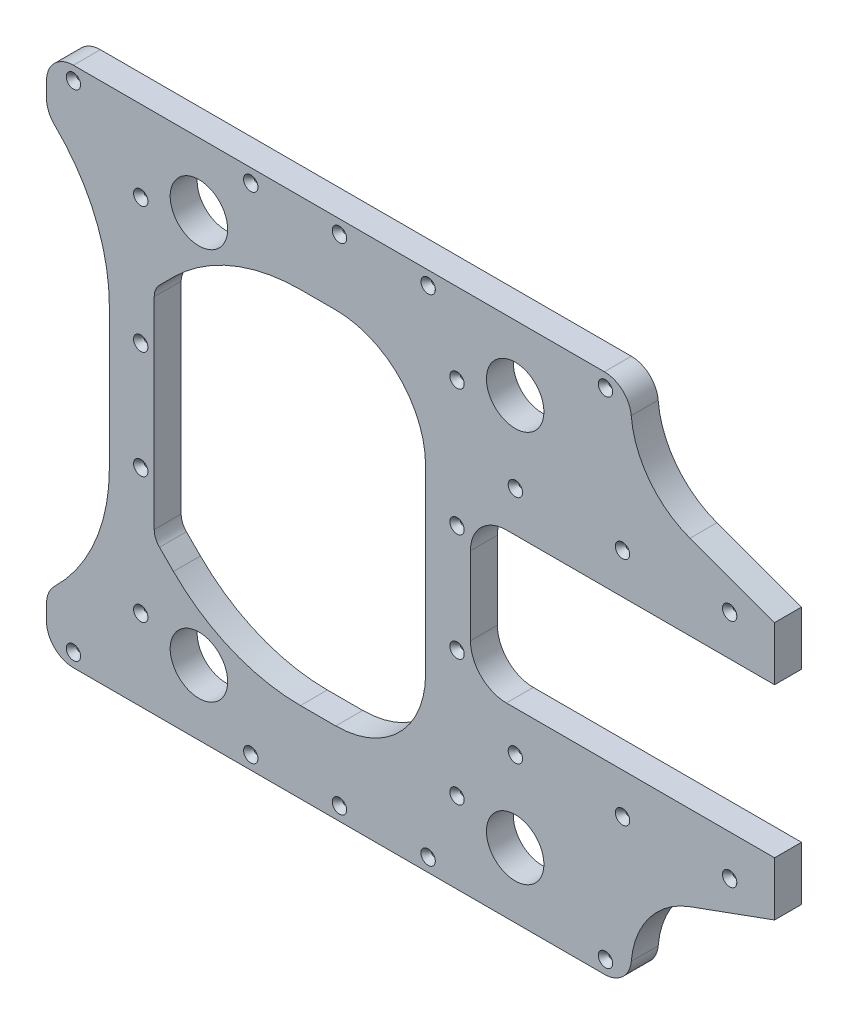
from build123d import *

# Parameters (mm, degrees)
SKETCH1_W                = 413.304725944
SKETCH1_H                = 369.049999988
BOSS_EXTRUDE1_DEPTH      = 19.05
F_1_1_6_DIAMETER_HOLE1_D = 40.64
SKETCH2_W                = 44.45
SKETCH2_H                = 292.849999988
CUT_EXTRUDE1_DEPTH       = 671.615895659
BOSS_EXTRUDE2_DEPTH      = 19.05
CUT_EXTRUDE2_DEPTH       = 760.092595873
FILLET1_R                = 127
FILLET2_R                = 63.5
FILLET3_R                = 19.05
SKETCH7_W                = 215.05772584
SKETCH7_H                = 105.949999994
CUT_EXTRUDE3_DEPTH       = 760.09259601
FILLET4_R                = 25.4
HOLE1_D                  = 3.175
HOLE1_DEPTH              = 38.1
HOLE1_CSINK_D            = 10.16
HOLE1_CSINK_ANGLE        = 82
HOLE1_TIP                = 0.953866233
FILLET5_R                = 12.7
FILLET6_R                = 127


with BuildPart() as part:
    # Sketch1 → Boss-Extrude1 (new body)
    with BuildSketch(Plane.XY):
        with Locations((365.066778756, -165.474999994)):
            Rectangle(SKETCH1_W, SKETCH1_H)
    extrude(amount=BOSS_EXTRUDE1_DEPTH)

    # 1 (1.6) Diameter Hole1 (through all)
    with Locations(Plane.XY.offset(19.05)):
        with Locations((489.857903131, -26.924), (489.857903131, -304.025999988), (266.210903131, -26.924), (266.210903131, -304.025999988)):
            Hole(F_1_1_6_DIAMETER_HOLE1_D / 2)

    # Sketch2 → Cut-Extrude1 (cut, through all)
    with BuildSketch(Plane.XY.offset(19.05)):
        Polygon((285.414415784, -292.849999988), (426.511415784, -292.849999988), (426.511415784, -38.1), (285.414415784, -38.1), (234.614415784, -88.9), (234.614415784, -242.049999988), align=None)
        with Locations((180.639415784, -165.474999994)):
            Rectangle(SKETCH2_W, SKETCH2_H)
    extrude(amount=-CUT_EXTRUDE1_DEPTH, mode=Mode.SUBTRACT)

    # Sketch3 → Boss-Extrude2 (add, through all)
    with BuildSketch(Plane.XY.offset(19.05)):
        Polygon((673.319141728, -256.549999991), (673.319141728, -74.399999997), (571.719141728, -37.420624196), (571.719141728, -293.529375793), align=None)
    extrude(amount=-BOSS_EXTRUDE2_DEPTH)

    # Sketch4 → Cut-Extrude2 (cut, through all)
    with BuildSketch(Plane.XY.offset(19.05)):
        with BuildLine():
            Line((515.411415784, -133.724999994), (616.169141728, -133.724999994))
            ThreePointArc((616.169141728, -133.724999994), (647.919141728, -165.474999994), (616.169141728, -197.224999994))
            Line((616.169141728, -197.224999994), (515.411415784, -197.224999994))
            ThreePointArc((515.411415784, -197.224999994), (483.661415784, -165.474999994), (515.411415784, -133.724999994))
        make_face()
    extrude(amount=-CUT_EXTRUDE2_DEPTH, mode=Mode.SUBTRACT)

    # Fillet1
    # the kernel refuses this fillet: 127 mm, written as the material it adds along each edge
    with BuildSketch(Plane(origin=(202.864415784, -311.899999988, 19.05), x_dir=(-1, 0, 0), z_dir=(0, 0, -1))) as fillet1_piece_1:
        with BuildLine():
            CenterArc((127, 96.511644375), FILLET1_R, 180, 49.458398126)
            Line((0, 96.511644375), (-2.54, 96.511644375))
            Line((-2.54, 96.511644375), (-2.54, 0))
            Line((-2.54, 0), (0, -2.54))
            ThreePointArc((0, -2.54), (22.225, -2.54), (42.799, -1.930232888))
            Line((42.799, -1.930232888), (44.45, 0))
        make_face()
    extrude(amount=19.05)
    with BuildSketch(Plane(origin=(202.864415784, -19.05, 19.05), x_dir=(-1, 0, 0), z_dir=(0, 0, -1))) as fillet1_piece_2:
        with BuildLine():
            CenterArc((127, -96.511644375), FILLET1_R, 130.541601874, 49.458398126)
            Line((0, -96.511644375), (-2.54, -96.511644375))
            Line((-2.54, -96.511644375), (-2.54, 0))
            Line((-2.54, 0), (0, 2.54))
            ThreePointArc((0, 2.54), (22.225, 2.54), (42.799, 1.930232888))
            Line((42.799, 1.930232888), (44.45, 0))
        make_face()
    extrude(amount=19.05)

    # Fillet2
    fillet2_edges = [part.edges().sort_by_distance(p)[0] for p in [
        (426.511415784, -38.1, 9.525),
        (426.511415784, -292.849999988, 9.525),
        (571.719141728, -37.420624196, 9.525),
        (571.719141728, -293.529375793, 9.525),
    ]]
    fillet(fillet2_edges, radius=FILLET2_R)

    # Fillet3
    fillet3_edges = [part.edges().sort_by_distance(p)[0] for p in [
        (158.414415784, -19.05, 9.525),
        (158.414415784, 19.05, 9.525),
        (158.414415784, -311.899999988, 9.525),
        (158.414415784, -349.999999988, 9.525),
        (571.719141728, -349.999999988, 9.525),
        (571.719141728, 19.05, 9.525),
    ]]
    fillet(fillet3_edges, radius=FILLET3_R)

    # Sketch7 → Cut-Extrude3 (cut, through all)
    with BuildSketch(Plane.XY.offset(19.05)):
        with Locations((565.790278808, -165.474999994)):
            Rectangle(SKETCH7_W, SKETCH7_H)
    extrude(amount=-CUT_EXTRUDE3_DEPTH, mode=Mode.SUBTRACT)

    # Fillet4
    fillet4_edges = [part.edges().sort_by_distance(p)[0] for p in [
        (458.261415888, -218.449999991, 9.525),
        (458.261415888, -112.499999997, 9.525),
    ]]
    fillet(fillet4_edges, radius=FILLET4_R)

    # Hole1
    with Locations(Plane(origin=(-151.648354553, -165.474999994, 19.05), x_dir=(0, -1, 0), z_dir=(0, 0, 1))):
        with Locations((81.549999997, 717.438633361), (-81.549999997, 717.438633361), (-81.549999997, 641.659770441), (-81.549999997, 793.217496281), (-174.999999994, 705.391438111), (-174.999999994, 329.112770337), (-174.999999994, 579.965215507), (-174.999999994, 454.538992941), (-174.999999994, 517.252104224), (-127.374999994, 600.384770441), (-38.1, 600.384770441), (-127.374999994, 376.737770337), (-38.1, 376.737770337), (38.1, 376.737770337), (127.374999994, 376.737770337), (38.1, 600.384770441), (127.374999994, 600.384770441), (174.999999994, 517.252104224), (174.999999994, 454.538992941), (174.999999994, 579.965215507), (174.999999994, 329.112770337), (174.999999994, 705.391438111), (81.549999997, 793.217496281), (81.549999997, 641.659770441)):
            CounterSinkHole(HOLE1_D / 2, HOLE1_CSINK_D / 2, depth=HOLE1_DEPTH, counter_sink_angle=HOLE1_CSINK_ANGLE)
            with Locations((0, 0, -(HOLE1_DEPTH + HOLE1_TIP / 2))):  # 118° drill point
                Cone(0, HOLE1_D / 2, HOLE1_TIP, mode=Mode.SUBTRACT)

    # Fillet5
    fillet5_edges = [part.edges().sort_by_distance(p)[0] for p in [
        (234.614415784, -242.049999988, 9.525),
        (234.614415784, -88.9, 9.525),
    ]]
    fillet(fillet5_edges, radius=FILLET5_R)

    # Fillet6
    fillet6_edges = [part.edges().sort_by_distance(p)[0] for p in [
        (285.414415784, -292.849999988, 9.525),
        (285.414415784, -38.1, 9.525),
    ]]
    fillet(fillet6_edges, radius=FILLET6_R)


solid = part.part
